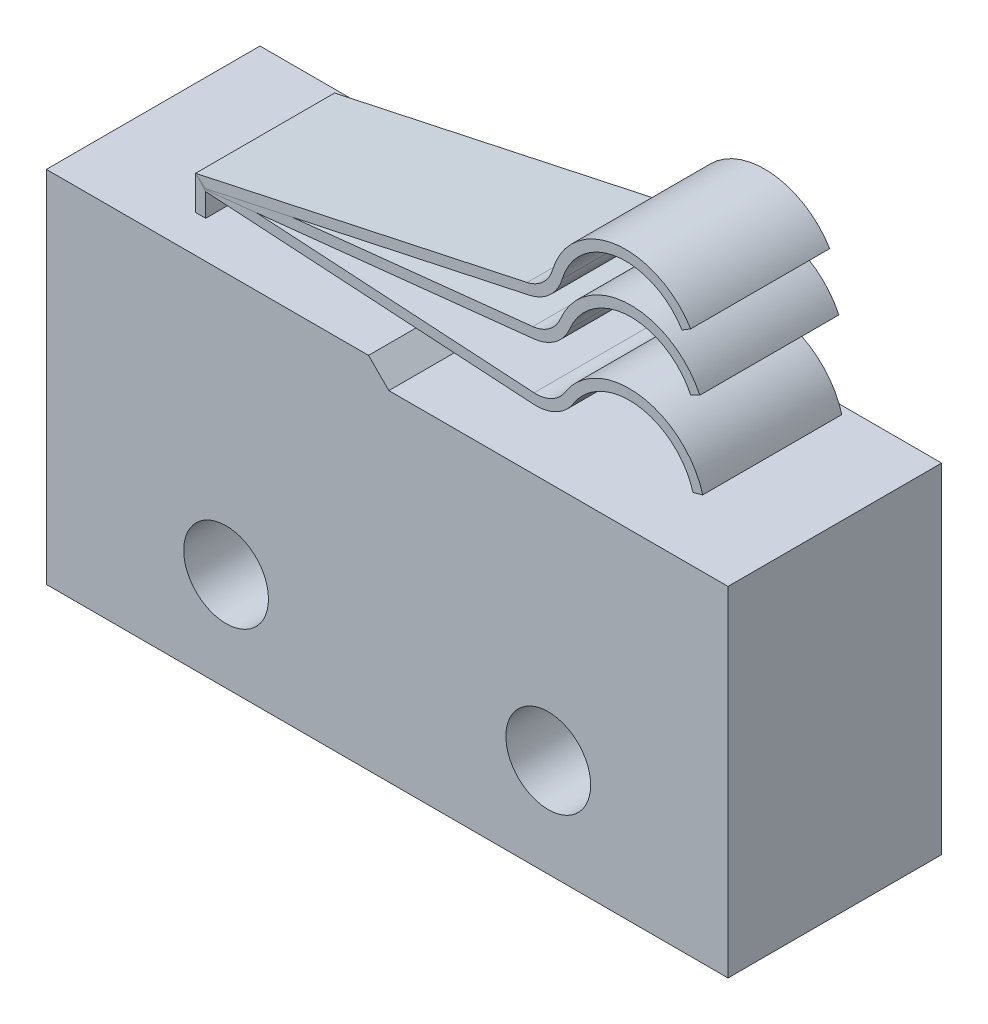
from build123d import *

# Parameters (mm, degrees)
SKETCH1_R           = 1.25
BOSS_EXTRUDE1_DEPTH = 3.15
BOSS_EXTRUDE2_DEPTH = 2.05
BOSS_EXTRUDE3_DEPTH = 2.05
BOSS_EXTRUDE4_DEPTH = 2.05


with BuildPart() as part:
    # Sketch1 → Boss-Extrude1 (new, symmetric)
    with BuildSketch(Plane.XY):
        Polygon((4.2, 7.7), (4.8, 7.1), (14.8, 7.1), (14.8, -2.9), (-5.3, -2.9), (-5.3, 7.7), align=None)
        Circle(SKETCH1_R, mode=Mode.SUBTRACT)
        with Locations((9.5, 0)):
            Circle(SKETCH1_R, mode=Mode.SUBTRACT)
    extrude(amount=BOSS_EXTRUDE1_DEPTH, both=True)


with BuildPart() as body_2:
    # Sketch2 → Boss-Extrude2 (new, symmetric)
    with BuildSketch(Plane.XY):
        with BuildLine():
            Line((-2, 7.7), (-2, 8.7))
            Line((-2, 8.7), (7.777013859, 10.8))
            ThreePointArc((7.777013859, 10.8), (8.246050439, 11.04359695), (8.52540848, 11.492254806))
            ThreePointArc((8.52540848, 11.492254806), (10.389553224, 13.080940147), (12.6, 12.02600802))
            Line((12.6, 12.02600802), (12.344239517, 11.869206951))
            ThreePointArc((12.344239517, 11.869206951), (10.428518978, 12.783481461), (8.812926867, 11.406620832))
            ThreePointArc((8.812926867, 11.406620832), (8.449761413, 10.823365619), (7.840013859, 10.506689584))
            Line((7.840013859, 10.506689584), (-1.7, 8.457594698))
            Line((-1.7, 8.457594698), (-1.7, 7.7))
            Line((-1.7, 7.7), (-2, 7.7))
        make_face()
    extrude(amount=BOSS_EXTRUDE2_DEPTH, both=True)


with BuildPart() as body_3:
    # Sketch3 → Boss-Extrude3 (new, symmetric)
    with BuildSketch(Plane.XY):
        with BuildLine():
            Line((-2, 7.7), (-2, 8.7))
            Line((-2, 8.7), (7.944007232, 9.756749817))
            ThreePointArc((7.944007232, 9.756749817), (8.436126819, 9.949501207), (8.761261588, 10.366181143))
            ThreePointArc((8.761261588, 10.366181143), (10.782617164, 11.749321908), (12.869425577, 10.467063202))
            Line((12.869425577, 10.467063202), (12.59854918, 10.338121442))
            ThreePointArc((12.59854918, 10.338121442), (10.789981889, 11.44941232), (9.03814039, 10.250690324))
            ThreePointArc((9.03814039, 10.250690324), (8.61546519, 9.709006407), (7.975709726, 9.4584296))
            Line((7.975709726, 9.4584296), (-1.7, 8.430191763))
            Line((-1.7, 8.430191763), (-1.7, 7.7))
            Line((-1.7, 7.7), (-2, 7.7))
        make_face()
    extrude(amount=BOSS_EXTRUDE3_DEPTH, both=True)


with BuildPart() as body_4:
    # Sketch4 → Boss-Extrude4 (new, symmetric)
    with BuildSketch(Plane.XY):
        with BuildLine():
            Line((-2, 8.7), (-2, 7.7))
            Line((-2, 7.7), (-1.7, 7.7))
            Line((-1.7, 7.7), (-1.7, 8.38095514))
            Line((-1.7, 8.38095514), (7.962646813, 7.785850956))
            ThreePointArc((7.962646813, 7.785850956), (8.635207878, 7.926340826), (9.142221759, 8.390035461))
            ThreePointArc((9.142221759, 8.390035461), (11.069289918, 9.280142968), (12.667436983, 7.88307138))
            Line((12.667436983, 7.88307138), (12.956009676, 7.965082361))
            ThreePointArc((12.956009676, 7.965082361), (11.111993832, 9.57708804), (8.888453648, 8.550040917))
            ThreePointArc((8.888453648, 8.550040917), (8.498442971, 8.193352736), (7.981088305, 8.085283605))
            Line((7.981088305, 8.085283605), (-2, 8.7))
        make_face()
    extrude(amount=BOSS_EXTRUDE4_DEPTH, both=True)


solid = Compound([part.part, body_2.part, body_3.part, body_4.part])
